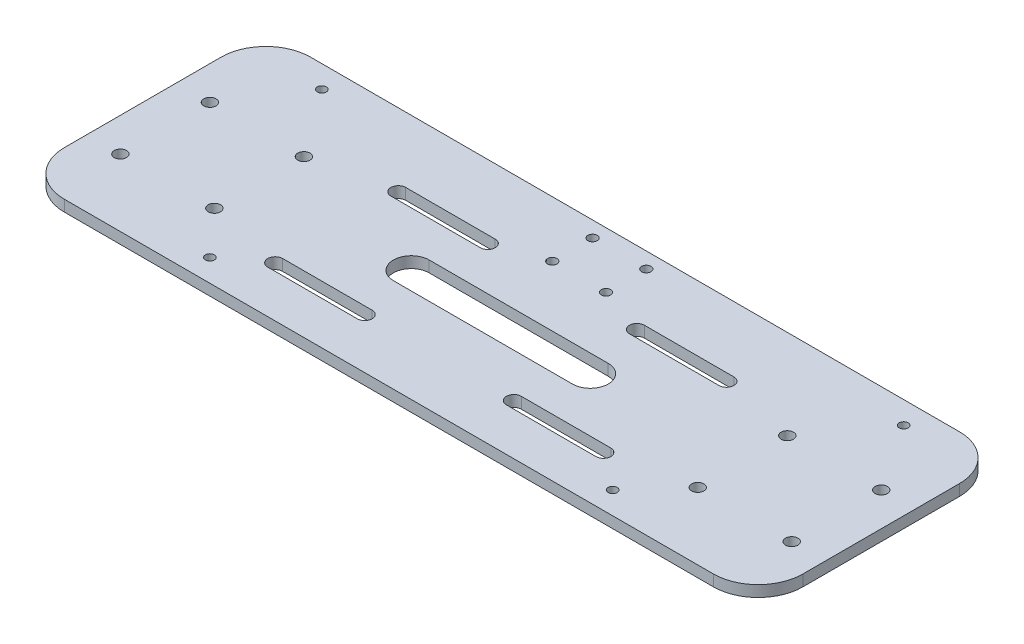
from build123d import *

# Parameters (mm, degrees)
SKETCH_1_W          = 330
SKETCH_1_H          = 110
EXTRUDE_1_DEPTH     = 5
SKETCH_3_R          = 2.1
CUT_EXTRUDE_1_DEPTH = 266.76264375
SKETCH_4_R          = 2.75
CUT_EXTRUDE_2_DEPTH = 266.76264375
SKETCH_5_R          = 2
CUT_EXTRUDE_3_DEPTH = 266.76264375
FILLET_1_R          = 20


with BuildPart() as part:
    # 草图1 → 凸台-拉伸1 (new body)
    with BuildSketch(Plane(origin=(0, 0, 0), x_dir=(1, 0, 0), z_dir=(0, 1, 0))):
        with Locations((9.630350195, -145.272373541)):
            Rectangle(SKETCH_1_W, SKETCH_1_H)
    extrude(amount=EXTRUDE_1_DEPTH)

    # 草图3 → 切除-拉伸1 (cut, through all)
    with BuildSketch(Plane(origin=(0, 5, 0), x_dir=(1, 0, 0), z_dir=(0, 1, 0))):
        with Locations((-2.369649805, -97.272373541)):
            Circle(SKETCH_3_R)
        with Locations((21.630350195, -97.272373541)):
            Circle(SKETCH_3_R)
        with Locations((-2.369649805, -115.272373541)):
            Circle(SKETCH_3_R)
        with Locations((21.630350195, -115.272373541)):
            Circle(SKETCH_3_R)
    extrude(amount=-CUT_EXTRUDE_1_DEPTH, mode=Mode.SUBTRACT)

    # 草图4 → 切除-拉伸2 (cut, through all)
    with BuildSketch(Plane(origin=(0, 5, 0), x_dir=(1, 0, 0), z_dir=(0, 1, 0))):
        with Locations((-140.369649805, -170.272373541)):
            Circle(SKETCH_4_R)
        with Locations((-140.369649805, -130.272373541)):
            Circle(SKETCH_4_R)
        with Locations((-98.369649805, -170.272373541)):
            Circle(SKETCH_4_R)
        with Locations((-98.369649805, -130.272373541)):
            Circle(SKETCH_4_R)
        with Locations((117.630350195, -130.272373541)):
            Circle(SKETCH_4_R)
        with Locations((117.630350195, -170.272373541)):
            Circle(SKETCH_4_R)
        with Locations((159.630350195, -130.272373541)):
            Circle(SKETCH_4_R)
        with Locations((159.630350195, -170.272373541)):
            Circle(SKETCH_4_R)
        with BuildLine():
            Line((-30.369649805, -142.272373541), (49.630350195, -142.272373541))
            ThreePointArc((49.630350195, -142.272373541), (57.630350195, -150.272373541), (49.630350195, -158.272373541))
            Line((49.630350195, -158.272373541), (-30.369649805, -158.272373541))
            ThreePointArc((-30.369649805, -158.272373541), (-38.369649805, -150.272373541), (-30.369649805, -142.272373541))
        make_face()
        with BuildLine():
            Line((-63.683730224, -119.443208484), (-23.683730224, -119.443208484))
            ThreePointArc((-23.683730224, -119.443208484), (-20.354565167, -122.772373541), (-23.683730224, -126.101538597))
            Line((-23.683730224, -126.101538597), (-63.683730224, -126.101538597))
            ThreePointArc((-63.683730224, -126.101538597), (-67.01289528, -122.772373541), (-63.683730224, -119.443208484))
        make_face()
        with BuildLine():
            Line((82.944430613, -119.443208484), (42.944430613, -119.443208484))
            ThreePointArc((42.944430613, -119.443208484), (39.615265556, -122.772373541), (42.944430613, -126.101538597))
            Line((42.944430613, -126.101538597), (82.944430613, -126.101538597))
            ThreePointArc((82.944430613, -126.101538597), (86.273595669, -122.772373541), (82.944430613, -119.443208484))
        make_face()
        with BuildLine():
            Line((-63.683730224, -181.101538597), (-23.683730224, -181.101538597))
            ThreePointArc((-23.683730224, -181.101538597), (-20.354565167, -177.772373541), (-23.683730224, -174.443208484))
            Line((-23.683730224, -174.443208484), (-63.683730224, -174.443208484))
            ThreePointArc((-63.683730224, -174.443208484), (-67.01289528, -177.772373541), (-63.683730224, -181.101538597))
        make_face()
        with BuildLine():
            Line((82.944430613, -181.101538597), (42.944430613, -181.101538597))
            ThreePointArc((42.944430613, -181.101538597), (39.615265556, -177.772373541), (42.944430613, -174.443208484))
            Line((42.944430613, -174.443208484), (82.944430613, -174.443208484))
            ThreePointArc((82.944430613, -174.443208484), (86.273595669, -177.772373541), (82.944430613, -181.101538597))
        make_face()
    extrude(amount=-CUT_EXTRUDE_2_DEPTH, mode=Mode.SUBTRACT)

    # 草图5 → 切除-拉伸3 (cut, through all)
    with BuildSketch(Plane(origin=(0, 5, 0), x_dir=(1, 0, 0), z_dir=(0, 1, 0))):
        with Locations((-120.369649805, -100.272373541)):
            Circle(SKETCH_5_R)
        with Locations((139.630350195, -100.272373541)):
            Circle(SKETCH_5_R)
        with Locations((-80.369649805, -190.272373541)):
            Circle(SKETCH_5_R)
        with Locations((99.630350195, -190.272373541)):
            Circle(SKETCH_5_R)
    extrude(amount=-CUT_EXTRUDE_3_DEPTH, mode=Mode.SUBTRACT)

    # 圆角1
    fillet_1_edges = [part.edges().sort_by_distance(p)[0] for p in [
        (174.630350195, 2.5, 200.272373541),
        (174.630350195, 2.5, 90.272373541),
        (-155.369649805, 2.5, 90.272373541),
        (-155.369649805, 2.5, 200.272373541),
    ]]
    fillet(fillet_1_edges, radius=FILLET_1_R)


solid = part.part
